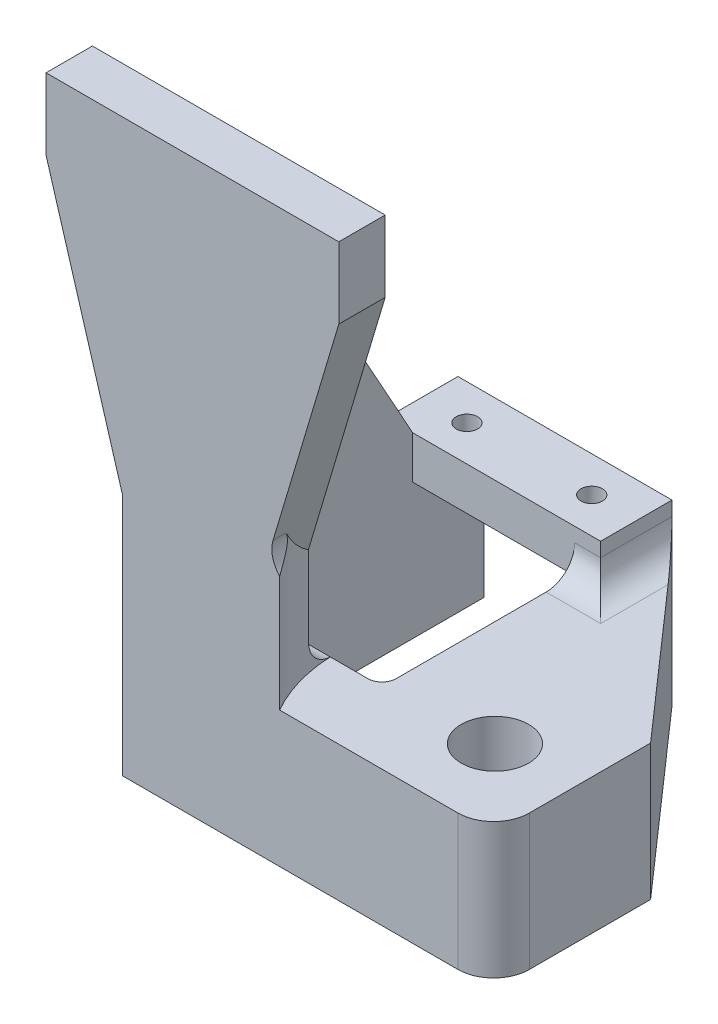
from build123d import *

# Parameters (mm, degrees)
SKETCH2_W            = 30
SKETCH2_H            = 10
BOSS_EXTRUDE1_DEPTH  = 25
SKETCH3_W            = 22.7
SKETCH3_H            = 19
CUT_EXTRUDE1_DEPTH   = 33.388133727
SKETCH4_R            = 1.5
CUT_EXTRUDE2_DEPTH   = 32.208832184
SKETCH5_W            = 3.65
SKETCH5_H            = 19
BOSS_EXTRUDE2_DEPTH  = 37
SKETCH6_W            = 3.65
SKETCH6_H            = 19
BOSS_EXTRUDE3_DEPTH  = 37
SKETCH11_W           = 10
SKETCH11_H           = 19
BOSS_EXTRUDE7_DEPTH  = 22.7
SKETCH12_W           = 5.2
SKETCH12_H           = 5.2
CUT_EXTRUDE4_DEPTH   = 11.1
SKETCH14_W           = 22
SKETCH14_H           = 19
BOSS_EXTRUDE8_DEPTH  = 22
SKETCH15_R           = 4.72
CUT_EXTRUDE6_DEPTH   = 62.032617987
BOSS_EXTRUDE9_DEPTH  = 15
BOSS_EXTRUDE11_DEPTH = 19
BOSS_EXTRUDE12_DEPTH = 6.5
BOSS_EXTRUDE13_DEPTH = 3.65
FILLET1_R            = 5
FILLET2_R            = 4
FILLET3_R            = 2
FILLET5_R            = 4


with BuildPart() as part:
    # Sketch2 → Boss-Extrude1 (new body)
    with BuildSketch(Plane(origin=(0, 0, 0), x_dir=(1, 0, 0), z_dir=(0, 1, 0))):
        with Locations((2.999755729, 0)):
            Rectangle(SKETCH2_W, SKETCH2_H)
    extrude(amount=BOSS_EXTRUDE1_DEPTH)

    # Sketch3 → Cut-Extrude1 (cut, through all)
    with BuildSketch(Plane.XY.offset(5)):
        with Locations((2.999755729, 9.5)):
            Rectangle(SKETCH3_W, SKETCH3_H)
    extrude(amount=-CUT_EXTRUDE1_DEPTH, mode=Mode.SUBTRACT)

    # Sketch4 → Cut-Extrude2 (cut, through all)
    with BuildSketch(Plane.XZ):
        with Locations(Location((-5.750244271, 0, 0), (0, 0, 270))):
            Circle(SKETCH4_R)
        with Locations(Location((11.749755729, 0, 0), (0, 0, 270))):
            Circle(SKETCH4_R)
    extrude(amount=-CUT_EXTRUDE2_DEPTH, mode=Mode.SUBTRACT)

    # Sketch5 → Boss-Extrude2 (add)
    with BuildSketch(Plane.XY.offset(5)):
        with Locations((16.174755729, 9.5)):
            Rectangle(SKETCH5_W, SKETCH5_H)
    extrude(amount=BOSS_EXTRUDE2_DEPTH)

    # Sketch6 → Boss-Extrude3 (add)
    with BuildSketch(Plane.XY.offset(5)):
        with Locations((-10.175244271, 9.5)):
            Rectangle(SKETCH6_W, SKETCH6_H)
    extrude(amount=BOSS_EXTRUDE3_DEPTH)

    # Sketch11 → Boss-Extrude7 (add)
    with BuildSketch(Plane.ZY.offset(-14.349755729)):
        with Locations((37, 9.5)):
            Rectangle(SKETCH11_W, SKETCH11_H)
    extrude(amount=BOSS_EXTRUDE7_DEPTH)

    # Sketch12 → Cut-Extrude4 (cut)
    with BuildSketch(Plane.XZ):
        with Locations((2.999755729, 34.6)):
            Rectangle(SKETCH12_W, SKETCH12_H)
    extrude(amount=-CUT_EXTRUDE4_DEPTH, mode=Mode.SUBTRACT)

    # Sketch14 → Boss-Extrude8 (add)
    with BuildSketch(Plane(origin=(17.999755729, 0, 0), x_dir=(0, 0, -1), z_dir=(1, 0, 0))):
        with Locations((-31, 9.5)):
            Rectangle(SKETCH14_W, SKETCH14_H)
    extrude(amount=BOSS_EXTRUDE8_DEPTH)

    # Sketch15 → Cut-Extrude6 (cut, through all)
    with BuildSketch(Plane(origin=(0, 19, 0), x_dir=(1, 0, 0), z_dir=(0, 1, 0))):
        with Locations(Location((29.179755729, -31, 0), (0, 0, 270))):
            Circle(SKETCH15_R)
    extrude(amount=-CUT_EXTRUDE6_DEPTH, mode=Mode.SUBTRACT)

    # Sketch16 → Boss-Extrude9 (add)
    with BuildSketch(Plane(origin=(0, 19, 0), x_dir=(1, 0, 0), z_dir=(0, 1, 0))):
        with BuildLine():
            Line((-12.000244271, -42), (9.999755729, -42))
            ThreePointArc((9.999755729, -42), (8.508821331, -38.847602891), (7.532067631, -35.5))
            Line((7.532067631, -35.5), (-12.000244271, -35.5))
            Line((-12.000244271, -35.5), (-12.000244271, -42))
        make_face()
    extrude(amount=BOSS_EXTRUDE9_DEPTH)

    # Sketch18 → Boss-Extrude11 (add)
    with BuildSketch(Plane(origin=(0, 19, 0), x_dir=(1, 0, 0), z_dir=(0, 1, 0))):
        Polygon((17.999755729, -20), (17.999755729, 5), (39.999755729, -20), align=None)
    extrude(amount=-BOSS_EXTRUDE11_DEPTH)

    # Sketch19 → Boss-Extrude12 (add)
    with BuildSketch(Plane.XY.offset(42)):
        Polygon((-22.755932023, 80), (18.287755383, 80), (18.287755383, 70), (7.532067631, 34), (-12.000244271, 34), (-22.755932023, 70), align=None)
    extrude(amount=-BOSS_EXTRUDE12_DEPTH)

    # Sketch20 → Boss-Extrude13 (add)
    with BuildSketch(Plane.ZY.offset(12.000244271)):
        Polygon((5, 25), (35.5, 80), (35.5, 19), (5, 19), align=None)
    extrude(amount=-BOSS_EXTRUDE13_DEPTH)

    # Fillet1
    fillet1_edges = [part.edges().sort_by_distance(p)[0] for p in [
        (39.999755729, 9.5, 42),
    ]]
    fillet(fillet1_edges, radius=FILLET1_R)

    # Fillet2
    # the kernel refuses this fillet: 4 mm, written as the material it adds along each edge
    with BuildSketch(Plane(origin=(17.999755729, 19, 5), x_dir=(1, 0, 0), z_dir=(0, 0, -1))) as fillet2_piece_1_section:
        with BuildLine():
            CenterArc((FILLET2_R, -FILLET2_R), FILLET2_R, 90, 90)
            Line((0, -FILLET2_R), (0, 0))
            Line((0, 0), (FILLET2_R, 0))
        make_face()
    fillet2_piece_1 = extrude(amount=20, mode=Mode.PRIVATE)
    fillet2_piece_1 = split(fillet2_piece_1, bisect_by=Plane(origin=(22.959178632, 19, 0.635707845), z_dir=(-0.7507135169227555, 0, 0.6606278948920247)), keep=Keep.TOP, mode=Mode.PRIVATE)
    add(fillet2_piece_1)
    with BuildSketch(Plane(origin=(-12.000244271, 90, 35.5), x_dir=(0, 0, -1), z_dir=(0, -1, 0))) as fillet2_piece_2_section:
        with BuildLine():
            CenterArc((FILLET2_R, -FILLET2_R), FILLET2_R, 90, 90)
            Line((0, -FILLET2_R), (0, 0))
            Line((0, 0), (FILLET2_R, 0))
        make_face()
    fillet2_piece_2 = extrude(amount=66, mode=Mode.PRIVATE)
    fillet2_piece_2 = split(fillet2_piece_2, bisect_by=Plane(origin=(-27.36023555, 85.410909165, 35.5), z_dir=(0.9581502749407442, 0.2862656993615832, 0)), keep=Keep.TOP, mode=Mode.PRIVATE)
    fillet2_piece_2 = split(fillet2_piece_2, bisect_by=Plane(origin=(-12.000244271, 87.648062701, 39.741198407), z_dir=(0, -0.48496776166331645, 0.8745320292289315)), keep=Keep.TOP, mode=Mode.PRIVATE)
    add(fillet2_piece_2)
    with BuildSketch(Plane(origin=(17.999755729, 19, 5), x_dir=(0, 0, 1), z_dir=(-1, 0, 0))) as fillet2_piece_3:
        with BuildLine():
            CenterArc((FILLET2_R, FILLET2_R), FILLET2_R, 180, 90)
            Line((0, FILLET2_R), (0, 0))
            Line((0, 0), (FILLET2_R, 0))
        make_face()
    extrude(amount=3.65)
    with BuildSketch(Plane(origin=(17.453635047, 19, 35.5), x_dir=(0, 0, -1), z_dir=(-1, 0, 0))) as fillet2_piece_4_section:
        with BuildLine():
            CenterArc((4, -3.968626967), FILLET2_R, 97.180755781, 82.819244219)
            Line((0, -3.968626967), (0, 0))
            Line((0, 0), (3.5, 0))
        make_face()
    fillet2_piece_4 = extrude(amount=35.725446735, mode=Mode.PRIVATE)
    fillet2_piece_4 = fillet2_piece_4 - Plane(origin=(29.179755729, 19, 31), x_dir=(-0.8674627670502353, 0, 0.49750210831869773), z_dir=(0, -1, 0)) * Cylinder(22.110459064, 88, mode=Mode.PRIVATE)
    fillet2_piece_4 = split(fillet2_piece_4, bisect_by=Plane(origin=(-12.000244271, 19, 35.5), z_dir=(1, 0, 0)), keep=Keep.TOP, mode=Mode.PRIVATE)
    add(fillet2_piece_4)
    with BuildSketch(Plane(origin=(17.999755729, 19, 15), x_dir=(1, 0, 0), z_dir=(0, 0, -1))) as fillet2_piece_5a_section:
        with BuildLine():
            CenterArc((FILLET2_R, -FILLET2_R), FILLET2_R, 90, 90)
            Line((0, -FILLET2_R), (0, 0))
            Line((0, 0), (FILLET2_R, 0))
        make_face()
    fillet2_piece_5a = extrude(amount=20, mode=Mode.PRIVATE)
    fillet2_piece_5a = split(fillet2_piece_5a, bisect_by=Plane(origin=(17.999755729, 19, 5), z_dir=(0, 0, 1)), keep=Keep.TOP, mode=Mode.PRIVATE)
    with BuildSketch(Plane(origin=(27.999755729, 19, 5), x_dir=(0, 0, 1), z_dir=(-1, 0, 0))) as fillet2_piece_5b_section:
        with BuildLine():
            CenterArc((FILLET2_R, FILLET2_R), FILLET2_R, 180, 90)
            Line((0, FILLET2_R), (0, 0))
            Line((0, 0), (FILLET2_R, 0))
        make_face()
    fillet2_piece_5b = extrude(amount=13.65, mode=Mode.PRIVATE)
    fillet2_piece_5b = split(fillet2_piece_5b, bisect_by=Plane(origin=(27.323470787, 19, 5.595130748), z_dir=(-0.7507135169227555, 0, 0.6606278948920247)), keep=Keep.TOP, mode=Mode.PRIVATE)
    fillet2_piece_5b = split(fillet2_piece_5b, bisect_by=Plane(origin=(17.999755729, 19, 5), z_dir=(1, 0, 0)), keep=Keep.TOP, mode=Mode.PRIVATE)
    fillet2_piece_5 = fillet2_piece_5a & fillet2_piece_5b
    add(fillet2_piece_5)

    # Fillet3
    fillet3_edges = [part.edges().sort_by_distance(p)[0] for p in [
        (14.349755729, 9.5, 32),
        (-8.350244271, 9.5, 32),
    ]]
    fillet(fillet3_edges, radius=FILLET3_R)

    # Fillet5
    # the kernel refuses this fillet: 4 mm, written as the material it adds along each edge
    with BuildSketch(Plane(origin=(7.532067631, 34, 42), x_dir=(0.2862656993615828, 0.9581502749407443, 0), z_dir=(0, 0, -1))) as fillet5_piece_1_section:
        with BuildLine():
            CenterArc((FILLET5_R * 1.34244672574, FILLET5_R), FILLET5_R, 163.365479622, 106.634520378)
            Line((FILLET5_R * 0.3842964508, FILLET5_R * 1.28626569936), (0, 0))
            Line((0, 0), (FILLET5_R * 1.34244672574, 0))
        make_face()
    fillet5_piece_1 = extrude(amount=6.5, mode=Mode.PRIVATE)
    fillet5_piece_1 = fillet5_piece_1 - Plane(origin=(29.179755729, 34, 31), x_dir=(-0.8674627670500467, 0, 0.49750210831902675), z_dir=(0, -1, 0)) * Cylinder(22.110459064, 35, mode=Mode.PRIVATE)
    add(fillet5_piece_1)


solid = part.part
